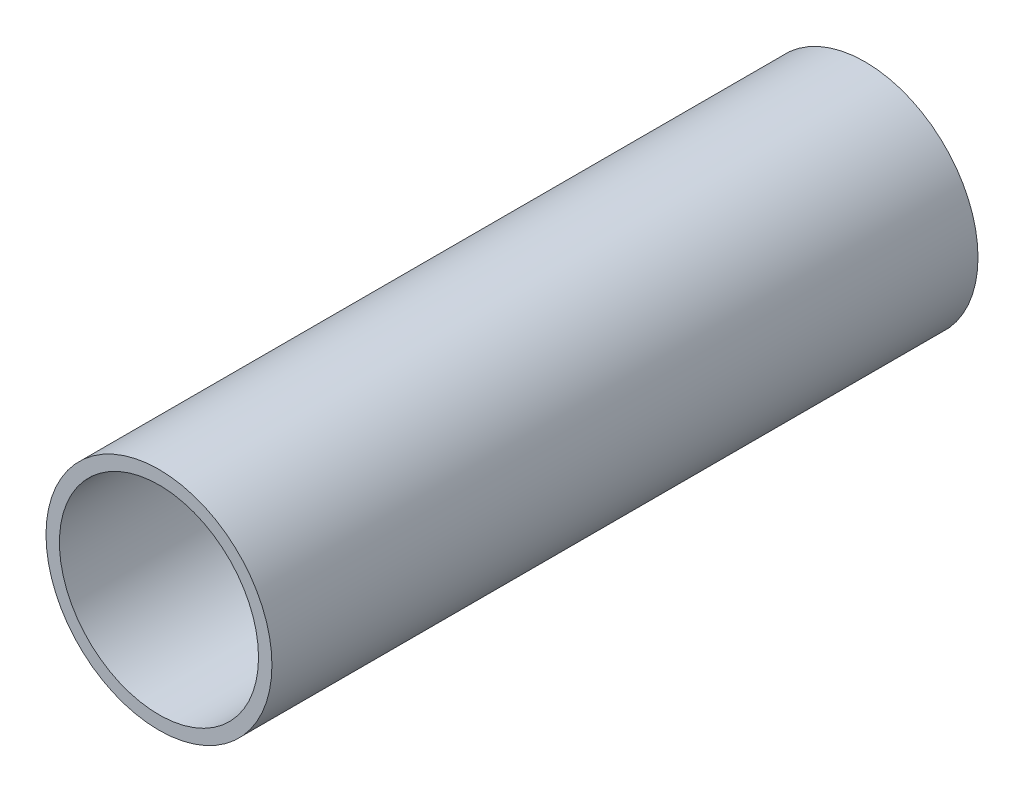
from build123d import *

# Parameters (mm, degrees)
PIPESKETCH_R    = 16
PIPESKETCH_R_2  = 14.1
EXTRUSION_DEPTH = 100


with BuildPart() as part:
    # PipeSketch → Extrusion (new body)
    with BuildSketch(Plane.XY):
        Circle(PIPESKETCH_R)
        Circle(PIPESKETCH_R_2, mode=Mode.SUBTRACT)
    extrude(amount=EXTRUSION_DEPTH)


solid = part.part
